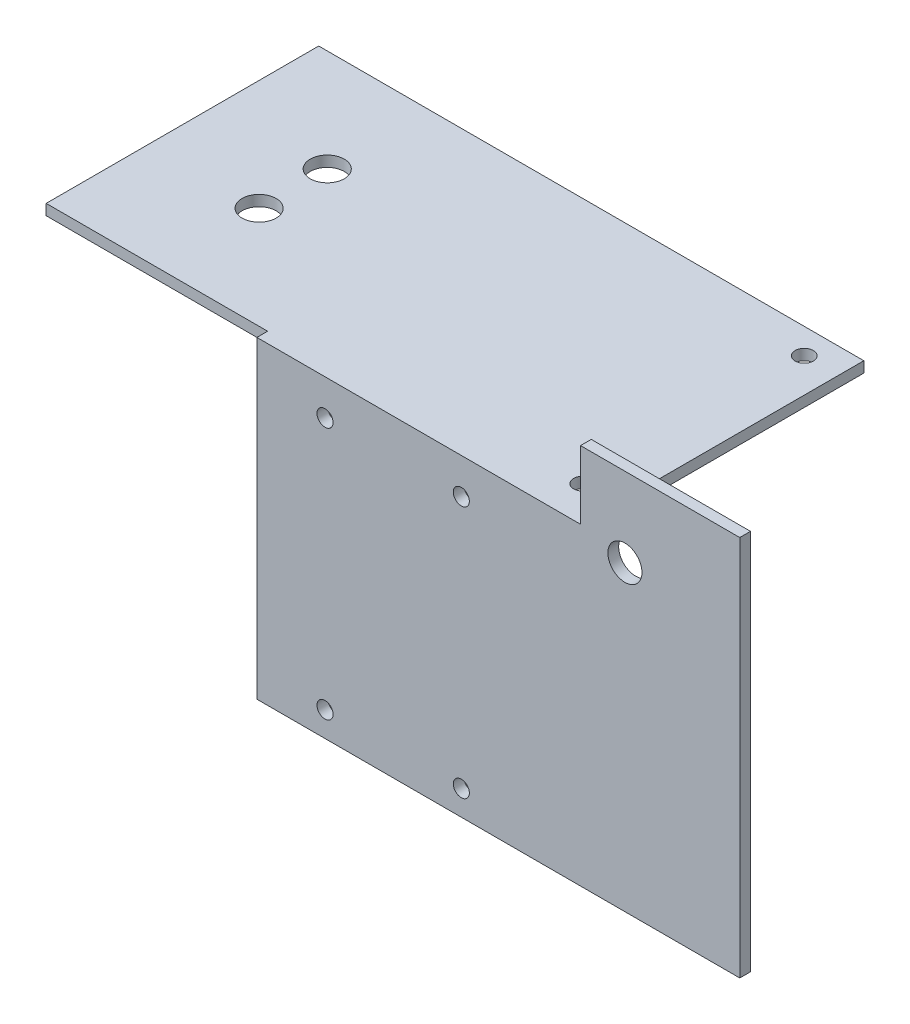
from build123d import *

# Parameters (mm, degrees)
SKETCH1_R           = 3.175
SKETCH1_R_2         = 1.5
BOSS_EXTRUDE1_DEPTH = 2
BOSS_EXTRUDE2_DEPTH = 50.8
SKETCH3_R           = 1.7
SKETCH3_R_2         = 3.175
CUT_EXTRUDE1_DEPTH  = 120.575917308


with BuildPart() as part:
    # Sketch1 → Boss-Extrude1 (new body)
    with BuildSketch(Plane.XY):
        Polygon((0, 58.4), (60.325, 58.4), (60.325, 71.1), (90, 71.1), (90, 0), (0, 0), align=None)
        with Locations((68.6, 56.33204182)):
            Circle(SKETCH1_R, mode=Mode.SUBTRACT)
        with Locations((12.7, 51.75)):
            Circle(SKETCH1_R_2, mode=Mode.SUBTRACT)
        with Locations((38.1, 51.75)):
            Circle(SKETCH1_R_2, mode=Mode.SUBTRACT)
        with Locations((12.7, 4.65)):
            Circle(SKETCH1_R_2, mode=Mode.SUBTRACT)
        with Locations((38.1, 4.65)):
            Circle(SKETCH1_R_2, mode=Mode.SUBTRACT)
    extrude(amount=-BOSS_EXTRUDE1_DEPTH)

    # Sketch2 → Boss-Extrude2 (add)
    with BuildSketch(Plane(origin=(0, 0, -2), x_dir=(-1, 0, 0), z_dir=(0, 0, -1))):
        Polygon((0, 56.4), (41.275, 56.4), (41.275, 58.4), (0, 58.4), (-60.325, 58.4), (-60.325, 56.4), align=None)
    extrude(amount=BOSS_EXTRUDE2_DEPTH)

    # Sketch3 → Cut-Extrude1 (cut, through all)
    with BuildSketch(Plane(origin=(0, 58.4, 0), x_dir=(1, 0, 0), z_dir=(0, 1, 0))):
        with Locations((53.975, 48.0375)):
            Circle(SKETCH3_R)
        with Locations((53.975, 6.7625)):
            Circle(SKETCH3_R)
        with Locations((-20.6375, 33.75)):
            Circle(SKETCH3_R_2)
        with Locations((-20.6375, 21.05)):
            Circle(SKETCH3_R_2)
    extrude(amount=-CUT_EXTRUDE1_DEPTH, mode=Mode.SUBTRACT)


solid = part.part
